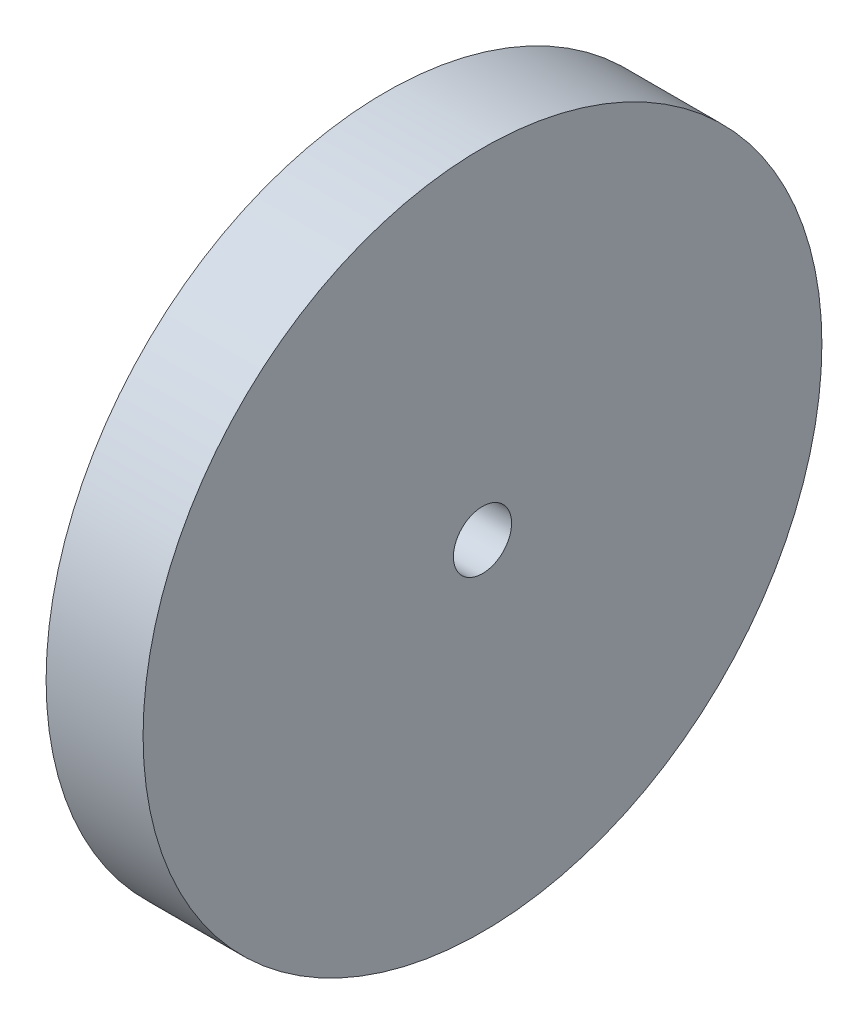
from build123d import *

# Parameters (mm, degrees)
SKETCH1_R           = 35
SKETCH1_R_2         = 3
BOSS_EXTRUDE1_DEPTH = 10


with BuildPart() as part:
    # Sketch1 → Boss-Extrude1 (new body)
    with BuildSketch(Plane(origin=(0, 0, 0), x_dir=(0, 0, -1), z_dir=(1, 0, 0))):
        Circle(SKETCH1_R)
        Circle(SKETCH1_R_2, mode=Mode.SUBTRACT)
    extrude(amount=BOSS_EXTRUDE1_DEPTH)


solid = part.part
